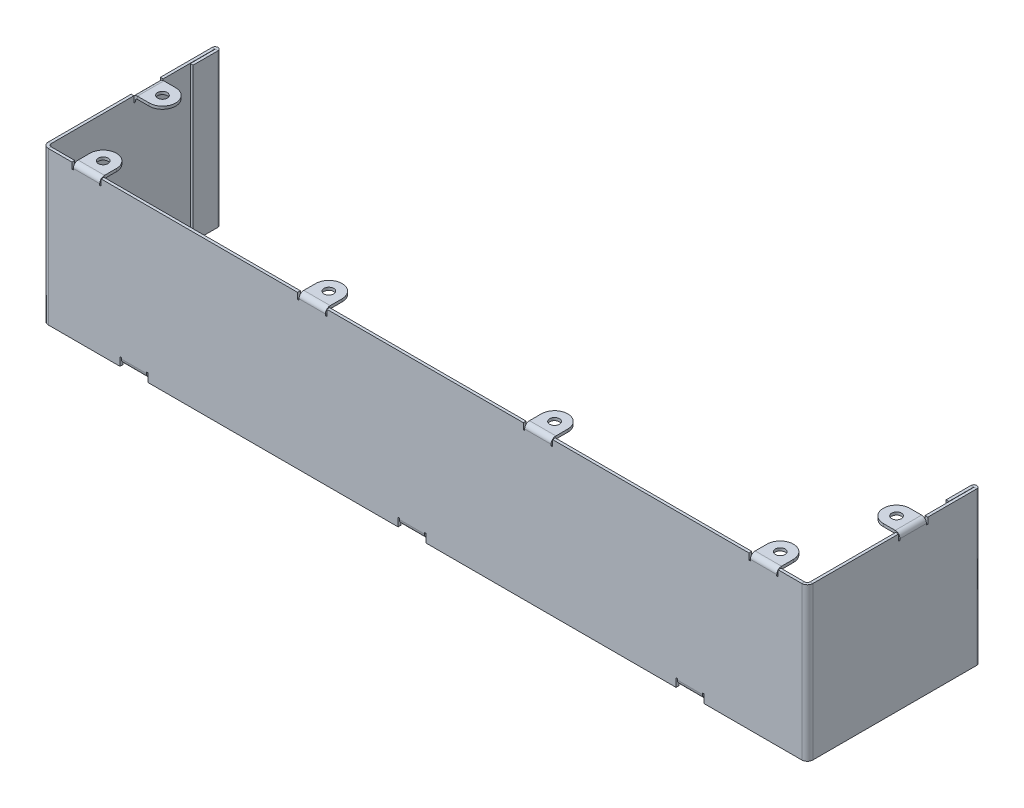
from build123d import *

# Parameters (mm, degrees)
SM_START                            = -1
SM_BASE_FLANGE_1_OUTLINE_W          = 137.5
SM_BASE_FLANGE_1_OUTLINE_H          = 55
SM_BASE_FLANGE_1_DEPTH              = 1
SM_EDGE_FLANGE_1_STRIP_W            = 6
SM_EDGE_FLANGE_1_STRIP_H            = 1
SM_EDGE_FLANGE_1_STRIP_CUT_DEPTH    = 55
SM_EDGE_FLANGE_1_DEPTH              = 55
OTHER_START                         = -27.5
OTHER_5_DEPTH                       = 55
OTHER_5_2_DEPTH                     = 55
SKETCH_23_W                         = 10
SKETCH_23_H                         = 0.8
CUT_EXTRUDE_1_DEPTH                 = 284.240622087
SM_EDGE_FLANGE_4_STRIP_W            = 5.4732
SM_EDGE_FLANGE_4_STRIP_H            = 1
SM_EDGE_FLANGE_4_STRIP_CUT_DEPTH    = 9
SM_EDGE_FLANGE_4_RELIEF_W           = 5.9732
SM_EDGE_FLANGE_4_RELIEF_H           = 0.5
SM_EDGE_FLANGE_4_RELIEF_CUT_DEPTH   = 1
SM_EDGE_FLANGE_4_DEPTH              = 9
SM_EDGE_FLANGE_4_PROFILE_R          = 2.45
SM_EDGE_FLANGE_4_FLAT_DEPTH         = 1
SM_EDGE_FLANGE_5_STRIP_W            = 5.4732
SM_EDGE_FLANGE_5_STRIP_H            = 1
SM_EDGE_FLANGE_5_STRIP_CUT_DEPTH    = 9.5
SM_EDGE_FLANGE_5_RELIEF_W           = 5.9732
SM_EDGE_FLANGE_5_RELIEF_H           = 0.5
SM_EDGE_FLANGE_5_RELIEF_CUT_DEPTH   = 1
SM_EDGE_FLANGE_5_DEPTH              = 9.5
SM_EDGE_FLANGE_5_PROFILE_R          = 1.750000004
SM_EDGE_FLANGE_5_FLAT_DEPTH         = 1
PATTERN_LINEAR_1_COUNT              = 4
PATTERN_LINEAR_1_PITCH              = 81.166666667
SM_EDGE_FLANGE_6_STRIP_W            = 5.4732
SM_EDGE_FLANGE_6_STRIP_H            = 1
SM_EDGE_FLANGE_6_STRIP_CUT_DEPTH    = 9.5
SM_EDGE_FLANGE_6_RELIEF_W           = 5.9732
SM_EDGE_FLANGE_6_RELIEF_H           = 0.5
SM_EDGE_FLANGE_6_RELIEF_CUT_DEPTH   = 1
SM_EDGE_FLANGE_6_STRIP_2_W          = 5.4732
SM_EDGE_FLANGE_6_STRIP_2_H          = 1
SM_EDGE_FLANGE_6_STRIP_CUT_2_DEPTH  = 9.5
SM_EDGE_FLANGE_6_RELIEF_2_W         = 5.9732
SM_EDGE_FLANGE_6_RELIEF_2_H         = 0.5
SM_EDGE_FLANGE_6_RELIEF_CUT_2_DEPTH = 1
SM_EDGE_FLANGE_6_DEPTH              = 9.5
SM_EDGE_FLANGE_6_PROFILE_R          = 1.75
SM_EDGE_FLANGE_6_FLAT_DEPTH         = 1
SM_EDGE_FLANGE_6_BEND_DEPTH         = 9.5
SM_EDGE_FLANGE_6_PROFILE_2_R        = 1.750000004
SM_EDGE_FLANGE_6_FLAT_2_DEPTH       = 1
PATTERN_LINEAR_3_COUNT              = 3
PATTERN_LINEAR_3_PITCH              = 100


# Read off the part's stored shape, not the designer's step: Базовая кромка1, Каемка5
# Sheet-metal steps are written as plain solids
with BuildPart() as part:
    # Базовая кромка1 outline → Базовая кромка1 (new body)
    with BuildSketch(Plane.XY.offset(SM_START)):
        with Locations((-68.75, 0)):
            Rectangle(SM_BASE_FLANGE_1_OUTLINE_W, SM_BASE_FLANGE_1_OUTLINE_H)
    extrude(amount=SM_BASE_FLANGE_1_DEPTH)

    # Ребро-кромка1 strip (across the edge) → Ребро-кромка1 strip cut (cut)
    with BuildSketch(Plane(origin=(0, 27.5, -1), x_dir=(-1, 0, 0), z_dir=(0, -1, 0))):
        with Locations((-1, -0.5)):
            Rectangle(SM_EDGE_FLANGE_1_STRIP_W, SM_EDGE_FLANGE_1_STRIP_H)
    extrude(amount=SM_EDGE_FLANGE_1_STRIP_CUT_DEPTH, mode=Mode.SUBTRACT)

    # Ребро-кромка1 section (across the edge) → Ребро-кромка1 (add)
    with BuildSketch(Plane(origin=(0, 27.5, -1), x_dir=(-1, 0, 0), z_dir=(0, -1, 0))):
        with BuildLine():
            Line((0, 1), (0, 61))
            Line((0, 61), (1, 61))
            Line((1, 61), (1, 1))
            ThreePointArc((1, 1), (1.292893219, 0.292893219), (2, 0))
            Line((2, 0), (2, -1))
            ThreePointArc((2, -1), (0.585786438, -0.414213562), (0, 1))
        make_face()
    extrude(amount=SM_EDGE_FLANGE_1_DEPTH)

    # Other 5 outline → Other 5 (cut)
    with BuildSketch(Plane(origin=(0, 0, 0), x_dir=(1, 0, 0), z_dir=(0, 1, 0)).offset(OTHER_START)):
        with BuildLine():
            Line((-1, 62), (-1, 61.998808848))
            ThreePointArc((-1, 61.998808848), (-0.290065792, 61.674568837), (0, 60.95))
            Line((0, 60.95), (0, 62))
            Line((0, 62), (-1, 62))
        make_face()
    extrude(amount=OTHER_5_DEPTH, mode=Mode.SUBTRACT)

    # Other 5 2 outline → Other 5 2 (add)
    with BuildSketch(Plane(origin=(0, 0, 0), x_dir=(1, 0, 0), z_dir=(0, 1, 0)).offset(OTHER_START)):
        with BuildLine():
            Line((-2.1, 52), (-1.1, 52))
            Line((-1.1, 52), (-1.1, 60.95))
            ThreePointArc((-1.1, 60.95), (-1.05, 61), (-1, 60.95))
            Line((-1, 60.95), (-1, 61.998808848))
            ThreePointArc((-1, 61.998808848), (-1.774568837, 61.709934208), (-2.1, 60.95))
            Line((-2.1, 60.95), (-2.1, 52))
        make_face()
    extrude(amount=OTHER_5_2_DEPTH)

    # Зеркальное отражение1: part across plane


with BuildPart() as part_1:
    add(part.part)
    add(part.part.mirror(Plane(origin=(-137.5, -27.5, -1), x_dir=(0, 0, 1), z_dir=(-1, 0, 0))))

    # Эскиз23 → Вырез-Вытянуть1 (cut, through all)
    with BuildSketch(Plane.XY):
        with Locations((-42.217724247, -27.1)):
            Rectangle(SKETCH_23_W, SKETCH_23_H)
    cut_extrude_1 = extrude(amount=-CUT_EXTRUDE_1_DEPTH, mode=Mode.SUBTRACT)

    # Ребро-кромка4 strip (across the edge) → Ребро-кромка4 strip cut (cut)
    with BuildSketch(Plane(origin=(-37.717724247, -26.7, -1), x_dir=(0, 1, 0), z_dir=(-1, 0, 0))):
        with Locations((-1, -0.5)):
            Rectangle(SM_EDGE_FLANGE_4_STRIP_W, SM_EDGE_FLANGE_4_STRIP_H)
    sm_edge_flange_4_strip_cut = extrude(amount=SM_EDGE_FLANGE_4_STRIP_CUT_DEPTH, mode=Mode.SUBTRACT)

    # Ребро-кромка4 relief (on the sheet) → Ребро-кромка4 relief cut (cut)
    with BuildSketch(Plane(origin=(-37.717724247, -24.9634, -1), x_dir=(0, 1, 0), z_dir=(0, 0, -1))):
        with Locations((-2.4866, 0.25)):
            Rectangle(SM_EDGE_FLANGE_4_RELIEF_W, SM_EDGE_FLANGE_4_RELIEF_H)
        with Locations((-2.4866, -9.25)):
            Rectangle(SM_EDGE_FLANGE_4_RELIEF_W, SM_EDGE_FLANGE_4_RELIEF_H)
    sm_edge_flange_4_relief_cut = extrude(amount=-SM_EDGE_FLANGE_4_RELIEF_CUT_DEPTH, mode=Mode.SUBTRACT)

    # Ребро-кромка4 bend section (across the edge) → Ребро-кромка4 (add)
    with BuildSketch(Plane(origin=(-37.717724247, -26.7, -1), x_dir=(0, 1, 0), z_dir=(-1, 0, 0))):
        with BuildLine():
            Line((0, 0.7366), (1, 0.7366))
            ThreePointArc((1, 0.7366), (1.215745145, 0.215745145), (1.7366, 0))
            Line((1.7366, 0), (1.7366, -1))
            ThreePointArc((1.7366, -1), (0.508638364, -0.491361636), (0, 0.7366))
        make_face()
    sm_edge_flange_4 = extrude(amount=SM_EDGE_FLANGE_4_DEPTH)

    # Ребро-кромка4 profile (on flange) → Ребро-кромка4 flat (add)
    with BuildSketch(Plane(origin=(0, -26.7, -1), x_dir=(-1, 0, 0), z_dir=(0, -1, 0))):
        with BuildLine():
            Line((37.717724247, 5), (37.717724247, 0.7366))
            Line((37.717724247, 0.7366), (46.717724247, 0.7366))
            Line((46.717724247, 0.7366), (46.717724247, 5))
            ThreePointArc((46.717724247, 5), (42.217724247, 9.5), (37.717724247, 5))
        make_face()
        with Locations((42.217724247, 5)):
            Circle(SM_EDGE_FLANGE_4_PROFILE_R, mode=Mode.SUBTRACT)
    sm_edge_flange_4_flat = extrude(amount=-SM_EDGE_FLANGE_4_FLAT_DEPTH)

    # Ребро-кромка5 strip (across the edge) → Ребро-кромка5 strip cut (cut)
    with BuildSketch(Plane(origin=(-264, 27.5, -1), x_dir=(0, -1, 0), z_dir=(1, 0, 0))):
        with Locations((-1, -0.5)):
            Rectangle(SM_EDGE_FLANGE_5_STRIP_W, SM_EDGE_FLANGE_5_STRIP_H)
    sm_edge_flange_5_strip_cut = extrude(amount=SM_EDGE_FLANGE_5_STRIP_CUT_DEPTH, mode=Mode.SUBTRACT)

    # Ребро-кромка5 relief (on the sheet) → Ребро-кромка5 relief cut (cut)
    with BuildSketch(Plane(origin=(-264, 25.7634, -1), x_dir=(0, -1, 0), z_dir=(0, 0, -1))):
        with Locations((-2.4866, 0.25)):
            Rectangle(SM_EDGE_FLANGE_5_RELIEF_W, SM_EDGE_FLANGE_5_RELIEF_H)
        with Locations((-2.4866, -9.75)):
            Rectangle(SM_EDGE_FLANGE_5_RELIEF_W, SM_EDGE_FLANGE_5_RELIEF_H)
    sm_edge_flange_5_relief_cut = extrude(amount=-SM_EDGE_FLANGE_5_RELIEF_CUT_DEPTH, mode=Mode.SUBTRACT)

    # Ребро-кромка5 bend section (across the edge) → Ребро-кромка5 (add)
    with BuildSketch(Plane(origin=(-264, 27.5, -1), x_dir=(0, -1, 0), z_dir=(1, 0, 0))):
        with BuildLine():
            Line((0, 0.7366), (1, 0.7366))
            ThreePointArc((1, 0.7366), (1.215745145, 0.215745145), (1.7366, 0))
            Line((1.7366, 0), (1.7366, -1))
            ThreePointArc((1.7366, -1), (0.508638364, -0.491361636), (0, 0.7366))
        make_face()
    sm_edge_flange_5 = extrude(amount=SM_EDGE_FLANGE_5_DEPTH)

    # Ребро-кромка5 profile (on flange) → Ребро-кромка5 flat (add)
    with BuildSketch(Plane(origin=(0, 27.5, -1), x_dir=(1, 0, 0), z_dir=(0, 1, 0))):
        with BuildLine():
            ThreePointArc((-254.5, 5), (-259.25, 9.75), (-264, 5))
            Line((-264, 5), (-264, 0.7366))
            Line((-264, 0.7366), (-254.5, 0.7366))
            Line((-254.5, 0.7366), (-254.5, 5))
        make_face()
        with Locations((-259.25, 5)):
            Circle(SM_EDGE_FLANGE_5_PROFILE_R, mode=Mode.SUBTRACT)
    sm_edge_flange_5_flat = extrude(amount=-SM_EDGE_FLANGE_5_FLAT_DEPTH)

    # Линейный массив1: Ребро-кромка5 strip cut, Ребро-кромка5 relief cut, Ребро-кромка5, Ребро-кромка5 flat ×4
    with Locations(*[(i * PATTERN_LINEAR_1_PITCH, 0, 0) for i in range(1, PATTERN_LINEAR_1_COUNT)]):
        add(sm_edge_flange_5_strip_cut, mode=Mode.SUBTRACT)
        add(sm_edge_flange_5_relief_cut, mode=Mode.SUBTRACT)
        add(sm_edge_flange_5)
        add(sm_edge_flange_5_flat)

    # Ребро-кромка6 strip (across the edge) → Ребро-кромка6 strip cut (cut)
    with BuildSketch(Plane(origin=(-274, 27.5, -41.810544315), x_dir=(0, -1, 0), z_dir=(0, 0, 1))):
        with Locations((-1, -0.5)):
            Rectangle(SM_EDGE_FLANGE_6_STRIP_W, SM_EDGE_FLANGE_6_STRIP_H)
    extrude(amount=SM_EDGE_FLANGE_6_STRIP_CUT_DEPTH, mode=Mode.SUBTRACT)

    # Ребро-кромка6 relief (on the sheet) → Ребро-кромка6 relief cut (cut)
    with BuildSketch(Plane(origin=(-274, 25.7634, -41.810544315), x_dir=(0, -1, 0), z_dir=(1, 0, 0))):
        with Locations((-2.4866, 0.25)):
            Rectangle(SM_EDGE_FLANGE_6_RELIEF_W, SM_EDGE_FLANGE_6_RELIEF_H)
        with Locations((-2.4866, -9.75)):
            Rectangle(SM_EDGE_FLANGE_6_RELIEF_W, SM_EDGE_FLANGE_6_RELIEF_H)
    extrude(amount=-SM_EDGE_FLANGE_6_RELIEF_CUT_DEPTH, mode=Mode.SUBTRACT)

    # Ребро-кромка6 strip 2 (across the edge) → Ребро-кромка6 strip cut 2 (cut)
    with BuildSketch(Plane(origin=(-1, 27.5, -33.333444131), x_dir=(0, -1, 0), z_dir=(0, 0, -1))):
        with Locations((-1, -0.5)):
            Rectangle(SM_EDGE_FLANGE_6_STRIP_2_W, SM_EDGE_FLANGE_6_STRIP_2_H)
    extrude(amount=SM_EDGE_FLANGE_6_STRIP_CUT_2_DEPTH, mode=Mode.SUBTRACT)

    # Ребро-кромка6 relief 2 (on the sheet) → Ребро-кромка6 relief cut 2 (cut)
    with BuildSketch(Plane(origin=(-1, 25.7634, -33.333444131), x_dir=(0, -1, 0), z_dir=(-1, 0, 0))):
        with Locations((-2.4866, 0.25)):
            Rectangle(SM_EDGE_FLANGE_6_RELIEF_2_W, SM_EDGE_FLANGE_6_RELIEF_2_H)
        with Locations((-2.4866, -9.75)):
            Rectangle(SM_EDGE_FLANGE_6_RELIEF_2_W, SM_EDGE_FLANGE_6_RELIEF_2_H)
    extrude(amount=-SM_EDGE_FLANGE_6_RELIEF_CUT_2_DEPTH, mode=Mode.SUBTRACT)

    # Ребро-кромка6 bend section (across the edge) → Ребро-кромка6 (add)
    with BuildSketch(Plane(origin=(-274, 27.5, -41.810544315), x_dir=(0, -1, 0), z_dir=(0, 0, 1))):
        with BuildLine():
            Line((0, 0.7366), (1, 0.7366))
            ThreePointArc((1, 0.7366), (1.215745145, 0.215745145), (1.7366, 0))
            Line((1.7366, 0), (1.7366, -1))
            ThreePointArc((1.7366, -1), (0.508638364, -0.491361636), (0, 0.7366))
        make_face()
    extrude(amount=SM_EDGE_FLANGE_6_DEPTH)

    # Ребро-кромка6 profile (on flange) → Ребро-кромка6 flat (add)
    with BuildSketch(Plane(origin=(-274, 27.5, 0), x_dir=(0, 0, 1), z_dir=(0, 1, 0))):
        with BuildLine():
            Line((-41.810544315, 5), (-41.810544315, 0.7366))
            Line((-41.810544315, 0.7366), (-32.310544315, 0.7366))
            Line((-32.310544315, 0.7366), (-32.310544315, 5))
            ThreePointArc((-32.310544315, 5), (-37.060544315, 9.75), (-41.810544315, 5))
        make_face()
        with Locations((-37.060544315, 5)):
            Circle(SM_EDGE_FLANGE_6_PROFILE_R, mode=Mode.SUBTRACT)
    extrude(amount=-SM_EDGE_FLANGE_6_FLAT_DEPTH)

    # Ребро-кромка6 bend section 2 (across the edge) → Ребро-кромка6 bend (add)
    with BuildSketch(Plane(origin=(-1, 27.5, -33.333444131), x_dir=(0, -1, 0), z_dir=(0, 0, -1))):
        with BuildLine():
            Line((0, 0.7366), (1, 0.7366))
            ThreePointArc((1, 0.7366), (1.215745145, 0.215745145), (1.7366, 0))
            Line((1.7366, 0), (1.7366, -1))
            ThreePointArc((1.7366, -1), (0.508638364, -0.491361636), (0, 0.7366))
        make_face()
    extrude(amount=SM_EDGE_FLANGE_6_BEND_DEPTH)

    # Ребро-кромка6 profile 2 (on flange) → Ребро-кромка6 flat 2 (add)
    with BuildSketch(Plane(origin=(-1, 27.5, 0), x_dir=(0, 0, -1), z_dir=(0, 1, 0))):
        with BuildLine():
            ThreePointArc((42.833444131, 5), (38.083444131, 9.75), (33.333444131, 5))
            Line((33.333444131, 5), (33.333444131, 0.7366))
            Line((33.333444131, 0.7366), (42.833444131, 0.7366))
            Line((42.833444131, 0.7366), (42.833444131, 5))
        make_face()
        with Locations((38.083444131, 5)):
            Circle(SM_EDGE_FLANGE_6_PROFILE_2_R, mode=Mode.SUBTRACT)
    extrude(amount=-SM_EDGE_FLANGE_6_FLAT_2_DEPTH)

    # Линейный массив3: Вырез-Вытянуть1, Ребро-кромка4 strip cut, Ребро-кромка4 relief cut, Ребро-кромка4, Ребро-кромка4 flat ×3
    with Locations(*[(-i * PATTERN_LINEAR_3_PITCH, 0, 0) for i in range(1, PATTERN_LINEAR_3_COUNT)]):
        add(cut_extrude_1, mode=Mode.SUBTRACT)
        add(sm_edge_flange_4_strip_cut, mode=Mode.SUBTRACT)
        add(sm_edge_flange_4_relief_cut, mode=Mode.SUBTRACT)
        add(sm_edge_flange_4)
        add(sm_edge_flange_4_flat)


solid = part_1.part
